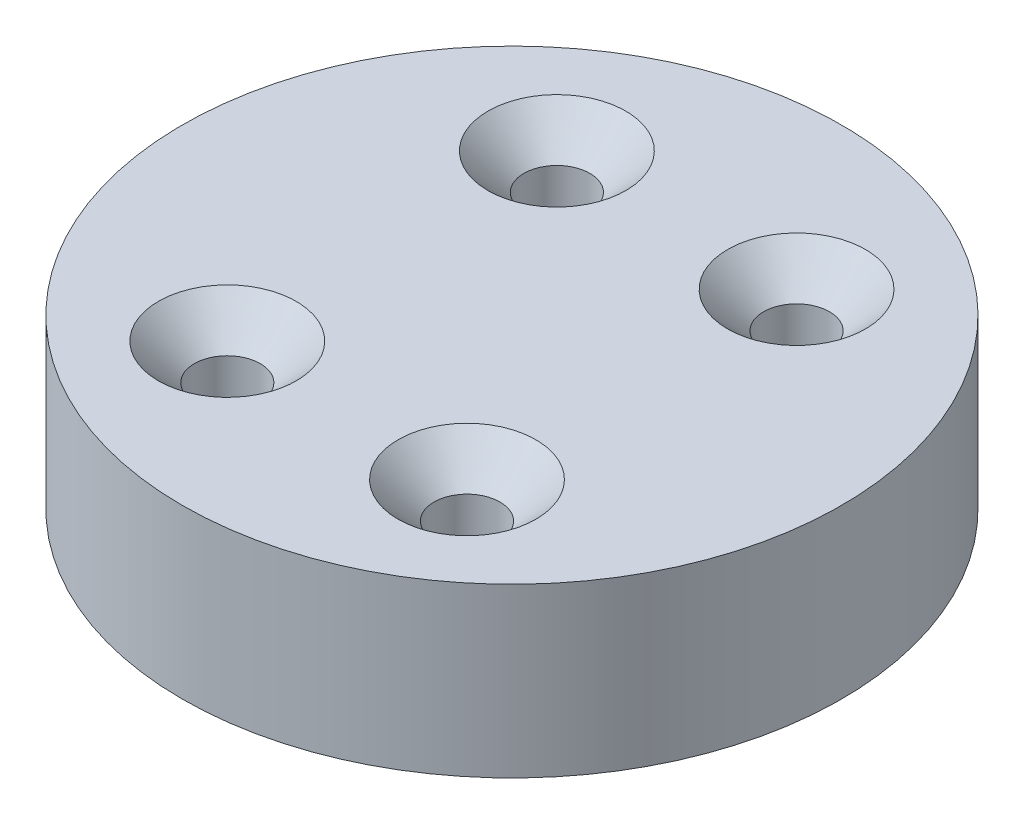
from build123d import *

# Parameters (mm, degrees)
SKETCH1_R           = 27.5
SKETCH1_R_2         = 2.75
BOSS_EXTRUDE1_DEPTH = 14
CHAMFER1_SIZE       = 3


with BuildPart() as part:
    # Sketch1 → Boss-Extrude1 (new body)
    with BuildSketch(Plane(origin=(0, 0, 0), x_dir=(1, 0, 0), z_dir=(0, 1, 0))):
        Circle(SKETCH1_R)
        with Locations((10, -13.75)):
            Circle(SKETCH1_R_2, mode=Mode.SUBTRACT)
        with Locations((-10, -13.75)):
            Circle(SKETCH1_R_2, mode=Mode.SUBTRACT)
        with Locations((-10, 13.75)):
            Circle(SKETCH1_R_2, mode=Mode.SUBTRACT)
        with Locations((10, 13.75)):
            Circle(SKETCH1_R_2, mode=Mode.SUBTRACT)
    extrude(amount=BOSS_EXTRUDE1_DEPTH)

    # Chamfer1
    chamfer1_edges = [part.edges().sort_by_distance(p)[0] for p in [
        (-12.75, 14, 13.75),
        (7.25, 14, 13.75),
        (7.25, 14, -13.75),
        (-12.75, 14, -13.75),
    ]]
    chamfer(chamfer1_edges, length=CHAMFER1_SIZE)


solid = part.part
